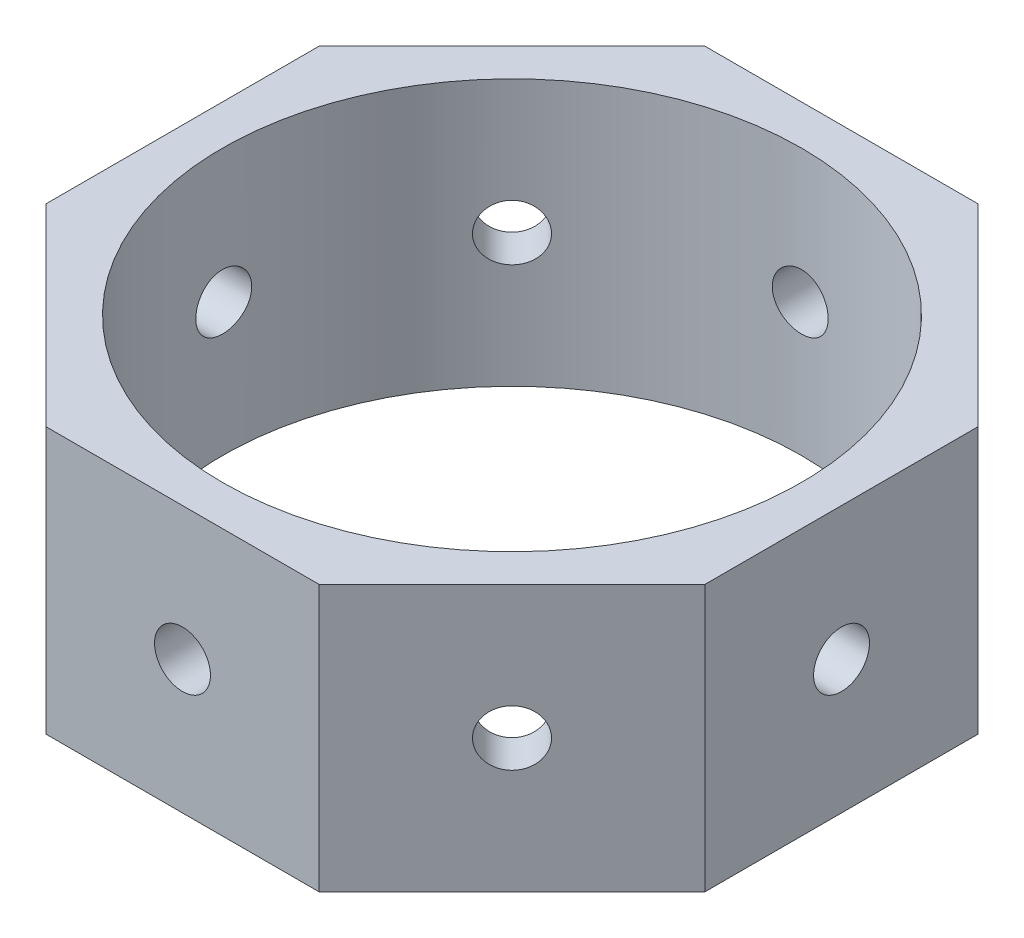
from build123d import *

# Parameters (mm, degrees)
SKETCH1_R           = 27.6225
BOSS_EXTRUDE1_DEPTH = 25.4
CUT_EXTRUDE1_REACH  = 76.734
SKETCH2_R           = 2.667
CIRPATTERN1_COUNT   = 8


with BuildPart() as part:
    # Sketch1 → Boss-Extrude1 (new body)
    with BuildSketch(Plane(origin=(0, 0, 0), x_dir=(1, 0, 0), z_dir=(0, 1, 0))):
        Polygon((13.019767799, 31.4325), (-13.019767799, 31.4325), (-31.4325, 13.019767799), (-31.4325, -13.019767799), (-13.019767799, -31.4325), (13.019767799, -31.4325), (31.4325, -13.019767799), (31.4325, 13.019767799), align=None)
        Circle(SKETCH1_R, mode=Mode.SUBTRACT)
    extrude(amount=BOSS_EXTRUDE1_DEPTH)

    # Sketch2 → Cut-Extrude1 (cut, up to next)
    with BuildSketch(Plane.XY.offset(31.4325), mode=Mode.PRIVATE) as cut_extrude1_sk1:
        with Locations((0, 12.7)):
            Circle(SKETCH2_R)
    cut_extrude1_tool1 = extrude(cut_extrude1_sk1.sketch, amount=-CUT_EXTRUDE1_REACH, mode=Mode.PRIVATE) & part.part
    cut_extrude1 = cut_extrude1_tool1.solids().sort_by_distance((0, 12.7, 31.4325))[0]
    add(cut_extrude1, mode=Mode.SUBTRACT)

    # CirPattern1: Cut-Extrude1 ×8 about axis
    cirpattern1_axis = Axis((0, 25.4, 0), (0, 1, 0))
    for i in range(1, CIRPATTERN1_COUNT):
        add(cut_extrude1.rotate(cirpattern1_axis, i * 360 / CIRPATTERN1_COUNT), mode=Mode.SUBTRACT)


solid = part.part
